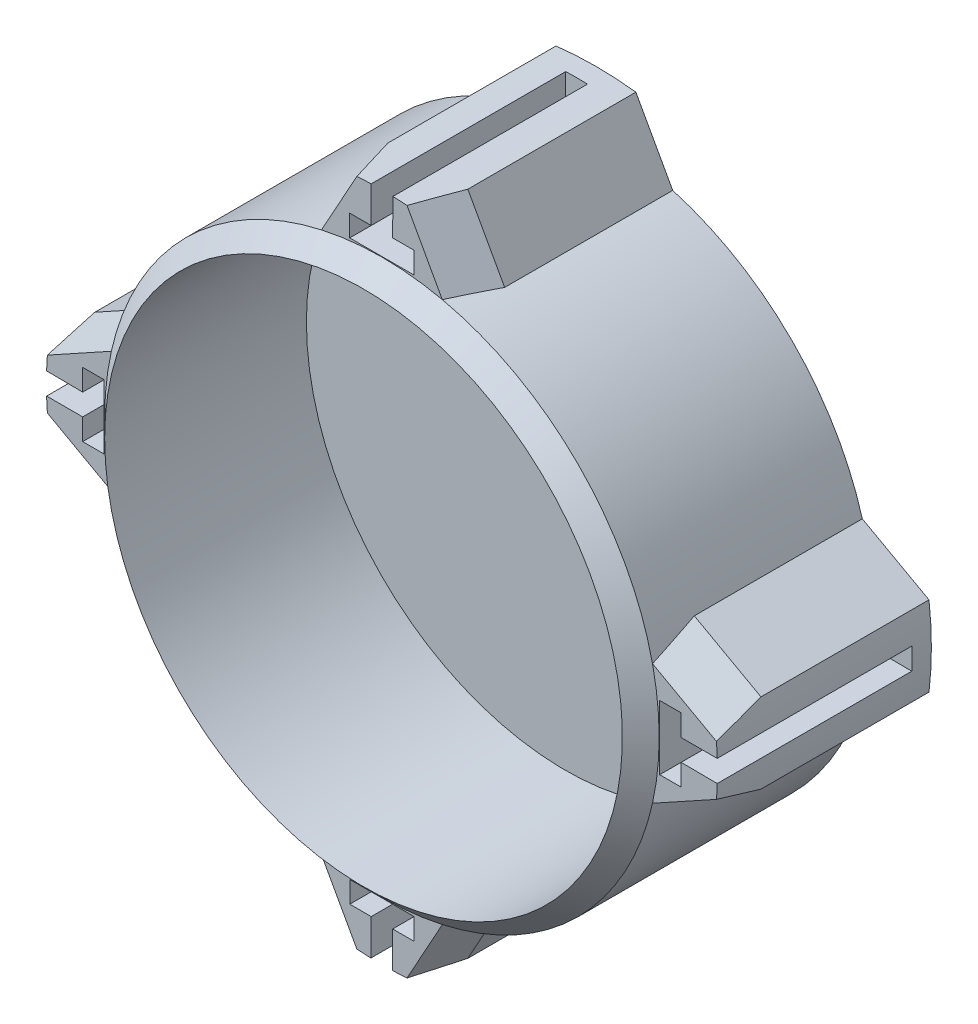
from build123d import *

# Parameters (mm, degrees)
SKETCH1_R           = 90.5
SKETCH1_R_2         = 84.5
BOSS_EXTRUDE1_DEPTH = 76.35
CHAMFER1_SIZE       = 6.5
WRAP12_SECTION_W    = 19
WRAP12_SECTION_H    = 69.85
WRAP12_ANGLE        = 32.161608832
CUT_EXTRUDE1_DEPTH  = 63.5
CHAMFER2_SIZE       = 19
CHAMFER5_SIZE       = 15
CHAMFER5_SIZE_2     = 4.019237886
CIRPATTERN6_COUNT   = 4
SKETCH15_R          = 84.5
BOSS_EXTRUDE2_DEPTH = 10


with BuildPart() as part:
    # Sketch1 → Boss-Extrude1 (new body)
    with BuildSketch(Plane.XY):
        Circle(SKETCH1_R)
        Circle(SKETCH1_R_2, mode=Mode.SUBTRACT)
    extrude(amount=BOSS_EXTRUDE1_DEPTH)

    # Chamfer1
    # the kernel refuses this chamfer: 6.5 mm, written as the material it takes off along each edge
    with BuildSketch(Plane(origin=(0, 0, 76.35), x_dir=(1, 0, 0), z_dir=(0, -1, 0))) as chamfer1_piece_1:
        Polygon((90.5, -CHAMFER1_SIZE), (90.5 - CHAMFER1_SIZE, 0), (90.5, 0), align=None)
    revolve(axis=Axis((0, 0, 76.35), (0, 0, 1)), mode=Mode.SUBTRACT)

    # Wrap12 section (on wrap section) → Wrap12 (revolve)
    with BuildSketch(Plane(origin=(0, 0, 0), x_dir=(0.9608717281441653, 0.276993722046629, 0), z_dir=(-0.276993722046629, 0.9608717281441653, 0))):
        with Locations((100, -34.925)):
            Rectangle(WRAP12_SECTION_W, WRAP12_SECTION_H)
    revolve(axis=Axis((0, 0, 0), (0, 0, -1)), revolution_arc=WRAP12_ANGLE)

    # Sketch12 → Cut-Extrude1 (cut)
    with BuildSketch(Plane.XY.offset(69.85)):
        Polygon((122.706651928, -0.201195148), (122.706651928, 3.507927311), (97.67138598, 3.507927311), (97.67138598, 10.503148948), (90.66864355, 10.503148948), (90.66864355, -10.492123054), (97.67138598, -10.492123054), (97.67138598, -3.492123054), (122.706651928, -3.70406248), align=None)
    extrude(amount=-CUT_EXTRUDE1_DEPTH, mode=Mode.SUBTRACT)

    # Chamfer2
    # the kernel refuses this chamfer: 19 mm, written as the material it takes off along each edge
    with BuildSketch(Plane(origin=(105.215515497, -30.330600038, 118.711976771), x_dir=(-0.9608722876451651, 0.27699178116967144, 0), z_dir=(0, 0, -1))) as chamfer2_piece_1_section:
        with BuildLine():
            Line((CHAMFER2_SIZE, 0), (1.420369251, 17.579630749))
            ThreePointArc((1.420369251, 17.579630749), (0.375784571, 9.063973019), (0, 0))
            Line((0, 0), (CHAMFER2_SIZE, 0))
        make_face()
    chamfer2_piece_1 = extrude(amount=167.573953543, mode=Mode.PRIVATE)
    chamfer2_piece_1 = chamfer2_piece_1 - Plane(origin=(0, 0, 118.711976771), x_dir=(1, 0, 0), z_dir=(0, 0, -1)) * Cylinder(90.5, 412, mode=Mode.PRIVATE)
    add(chamfer2_piece_1, mode=Mode.SUBTRACT)
    with BuildSketch(Plane(origin=(105.215454232, 30.330812564, 118.711976771), x_dir=(-0.9608717281441654, -0.2769937220466291, 0), z_dir=(0, 0, -1))) as chamfer2_piece_2_section:
        with BuildLine():
            Line((CHAMFER2_SIZE, 0), (1.420369251, -17.579630749))
            ThreePointArc((1.420369251, -17.579630749), (0.375784571, -9.063973019), (0, 0))
            Line((0, 0), (CHAMFER2_SIZE, 0))
        make_face()
    chamfer2_piece_2 = extrude(amount=167.573953543, mode=Mode.PRIVATE)
    chamfer2_piece_2 = chamfer2_piece_2 - Plane(origin=(0, 0, 118.711976771), x_dir=(1, 0, 0), z_dir=(0, 0, -1)) * Cylinder(90.5, 412, mode=Mode.PRIVATE)
    add(chamfer2_piece_2, mode=Mode.SUBTRACT)

    # Chamfer5
    # the kernel refuses this chamfer: 15, 4.019237886 mm, written as the material it takes off along each edge
    with BuildSketch(Plane(origin=(52.865116584, 43.903567605, 69.85), x_dir=(0, 0, -1), z_dir=(0.8753030540266438, -0.483574775615551, 0))) as chamfer5_piece_1_section:
        Polygon((CHAMFER5_SIZE, 0), (0, -CHAMFER5_SIZE_2), (0, 0), align=None)
    chamfer5_piece_1 = extrude(amount=102.762999332, mode=Mode.PRIVATE)
    chamfer5_piece_1 = chamfer5_piece_1 - Plane(origin=(0, 0, 69.85), x_dir=(1, 0, 0), z_dir=(0, 0, -1)) * Cylinder(90.5, 266, mode=Mode.PRIVATE)
    add(chamfer5_piece_1, mode=Mode.SUBTRACT)
    with BuildSketch(Plane(origin=(52.865205265, -43.903460822, 69.85), x_dir=(0, 0, -1), z_dir=(0.8753020772463168, 0.48357654364979585, 0))) as chamfer5_piece_2_section:
        Polygon((CHAMFER5_SIZE, 0), (0, CHAMFER5_SIZE_2), (0, 0), align=None)
    chamfer5_piece_2 = extrude(amount=102.762999332, mode=Mode.PRIVATE)
    chamfer5_piece_2 = chamfer5_piece_2 - Plane(origin=(0, 0, 69.85), x_dir=(1, 0, 0), z_dir=(0, 0, -1)) * Cylinder(90.5, 266, mode=Mode.PRIVATE)
    add(chamfer5_piece_2, mode=Mode.SUBTRACT)


with BuildPart() as cirpattern6_1:
    # CirPattern6: pattern copy
    add(part.part.rotate(Axis((0, 0, 0), (0, 0, 1)), 1 * 360 / CIRPATTERN6_COUNT))


with BuildPart() as cirpattern6_2:
    # CirPattern6: pattern copy
    add(part.part.rotate(Axis((0, 0, 0), (0, 0, 1)), 2 * 360 / CIRPATTERN6_COUNT))


with BuildPart() as cirpattern6_3:
    # CirPattern6: pattern copy
    add(part.part.rotate(Axis((0, 0, 0), (0, 0, 1)), 3 * 360 / CIRPATTERN6_COUNT))


with BuildPart() as part_1:
    add(part.part)

    add(cirpattern6_1.part)  # Boss-Extrude2 merges CirPattern6_1

    add(cirpattern6_2.part)  # Boss-Extrude2 merges CirPattern6_2

    add(cirpattern6_3.part)  # Boss-Extrude2 merges CirPattern6_3
    # Sketch15 → Boss-Extrude2 (add)
    with BuildSketch(Plane(origin=(0, 0, 0), x_dir=(-1, 0, 0), z_dir=(0, 0, -1))):
        Circle(SKETCH15_R)
    extrude(amount=-BOSS_EXTRUDE2_DEPTH)


solid = part_1.part
